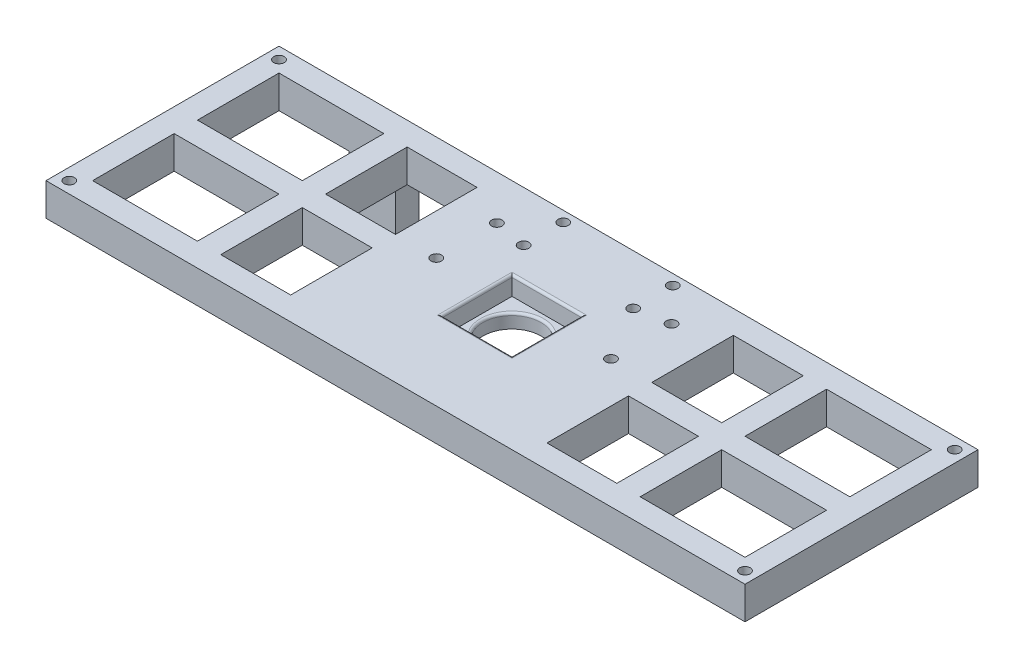
from build123d import *

# Parameters (mm, degrees)
SKETCH_1_W           = 300
SKETCH_1_H           = 100
EXTRUDE_1_DEPTH      = 16
SKETCH_2_W           = 30
SKETCH_2_H           = 30
CUT_EXTRUDE_1_DEPTH  = 8
SKETCH_3_R           = 12.5
CUT_EXTRUDE_2_DEPTH  = 14
CUT_EXTRUDE_3_REACH  = 318.632
SKETCH_4_W           = 50
SKETCH_4_H           = 35
SKETCH_7_W           = 35
SKETCH_7_H           = 16
EXTRUDE_2_DEPTH      = 20
SKETCH_8_W           = 35
SKETCH_8_H           = 16
EXTRUDE_3_DEPTH      = 20
SKETCH_9_W           = 20
SKETCH_9_H           = 10
EXTRUDE_4_DEPTH      = 25
FILLET_1_R           = 1
FILLET_2_R           = 1
SKETCH_13_W          = 35
SKETCH_13_H          = 16
EXTRUDE_6_DEPTH      = 4
SKETCH_14_W          = 35
SKETCH_14_H          = 16
EXTRUDE_7_DEPTH      = 4
SKETCH_17_W          = 35
SKETCH_17_H          = 16
EXTRUDE_8_DEPTH      = 1
SKETCH_18_W          = 35
SKETCH_18_H          = 16
EXTRUDE_9_DEPTH      = 1
SKETCH_19_R          = 2.25
CUT_EXTRUDE_8_DEPTH  = 5
CUT_EXTRUDE_START    = -7
SKETCH_20_R          = 2.25
CUT_EXTRUDE_9_DEPTH  = 7
SKETCH_21_R          = 1.45
CUT_EXTRUDE_10_DEPTH = 5
SKETCH_22_R          = 2.25
CUT_EXTRUDE_11_DEPTH = 5
SKETCH_23_R          = 1.45
CUT_EXTRUDE_12_DEPTH = 5
SKETCH_24_R          = 2.25
CUT_EXTRUDE_13_DEPTH = 5
CUT_EXTRUDE_15_DEPTH = 2


with BuildPart() as part:
    # 草图1 → 凸台-拉伸1 (new body)
    with BuildSketch(Plane(origin=(0, 0, 0), x_dir=(1, 0, 0), z_dir=(0, 1, 0))):
        with Locations((-150, 50)):
            Rectangle(SKETCH_1_W, SKETCH_1_H)
    extrude(amount=EXTRUDE_1_DEPTH)

    # 草图2 → 切除-拉伸1 (cut)
    with BuildSketch(Plane(origin=(0, 16, 0), x_dir=(1, 0, 0), z_dir=(0, 1, 0))):
        with Locations((-150, 50)):
            Rectangle(SKETCH_2_W, SKETCH_2_H)
    extrude(amount=-CUT_EXTRUDE_1_DEPTH, mode=Mode.SUBTRACT)

    # 草图3 → 切除-拉伸2 (cut)
    with BuildSketch(Plane(origin=(0, 8, 0), x_dir=(1, 0, 0), z_dir=(0, 1, 0))):
        with Locations((-150, 50)):
            Circle(SKETCH_3_R)
    extrude(amount=-CUT_EXTRUDE_2_DEPTH, mode=Mode.SUBTRACT)

    # 草图4 → 切除-拉伸3 (cut, up to next)
    with BuildSketch(Plane(origin=(0, 16, 0), x_dir=(1, 0, 0), z_dir=(0, 1, 0)), mode=Mode.PRIVATE) as cut_extrude_3_sk1:
        with Locations((-270, 72.5)):
            Rectangle(SKETCH_4_W, SKETCH_4_H)
    cut_extrude_3_tool1 = extrude(cut_extrude_3_sk1.sketch, amount=-CUT_EXTRUDE_3_REACH, mode=Mode.PRIVATE) & part.part
    # 草图4 → 切除-拉伸3 (cut, up to next)
    with BuildSketch(Plane(origin=(0, 16, 0), x_dir=(1, 0, 0), z_dir=(0, 1, 0)), mode=Mode.PRIVATE) as cut_extrude_3_sk2:
        with Locations((-270, 27.5)):
            Rectangle(SKETCH_4_W, SKETCH_4_H)
    cut_extrude_3_tool2 = extrude(cut_extrude_3_sk2.sketch, amount=-CUT_EXTRUDE_3_REACH, mode=Mode.PRIVATE) & part.part
    # 草图4 → 切除-拉伸3 (cut, up to next)
    with BuildSketch(Plane(origin=(0, 16, 0), x_dir=(1, 0, 0), z_dir=(0, 1, 0)), mode=Mode.PRIVATE) as cut_extrude_3_sk3:
        with Locations((-210, 72.5)):
            Rectangle(SKETCH_4_W, SKETCH_4_H)
    cut_extrude_3_tool3 = extrude(cut_extrude_3_sk3.sketch, amount=-CUT_EXTRUDE_3_REACH, mode=Mode.PRIVATE) & part.part
    # 草图4 → 切除-拉伸3 (cut, up to next)
    with BuildSketch(Plane(origin=(0, 16, 0), x_dir=(1, 0, 0), z_dir=(0, 1, 0)), mode=Mode.PRIVATE) as cut_extrude_3_sk4:
        with Locations((-210, 27.5)):
            Rectangle(SKETCH_4_W, SKETCH_4_H)
    cut_extrude_3_tool4 = extrude(cut_extrude_3_sk4.sketch, amount=-CUT_EXTRUDE_3_REACH, mode=Mode.PRIVATE) & part.part
    # 草图4 → 切除-拉伸3 (cut, up to next)
    with BuildSketch(Plane(origin=(0, 16, 0), x_dir=(1, 0, 0), z_dir=(0, 1, 0)), mode=Mode.PRIVATE) as cut_extrude_3_sk5:
        with Locations((-30, 27.5)):
            Rectangle(SKETCH_4_W, SKETCH_4_H)
    cut_extrude_3_tool5 = extrude(cut_extrude_3_sk5.sketch, amount=-CUT_EXTRUDE_3_REACH, mode=Mode.PRIVATE) & part.part
    # 草图4 → 切除-拉伸3 (cut, up to next)
    with BuildSketch(Plane(origin=(0, 16, 0), x_dir=(1, 0, 0), z_dir=(0, 1, 0)), mode=Mode.PRIVATE) as cut_extrude_3_sk6:
        with Locations((-90, 27.5)):
            Rectangle(SKETCH_4_W, SKETCH_4_H)
    cut_extrude_3_tool6 = extrude(cut_extrude_3_sk6.sketch, amount=-CUT_EXTRUDE_3_REACH, mode=Mode.PRIVATE) & part.part
    # 草图4 → 切除-拉伸3 (cut, up to next)
    with BuildSketch(Plane(origin=(0, 16, 0), x_dir=(1, 0, 0), z_dir=(0, 1, 0)), mode=Mode.PRIVATE) as cut_extrude_3_sk7:
        with Locations((-90, 72.5)):
            Rectangle(SKETCH_4_W, SKETCH_4_H)
    cut_extrude_3_tool7 = extrude(cut_extrude_3_sk7.sketch, amount=-CUT_EXTRUDE_3_REACH, mode=Mode.PRIVATE) & part.part
    # 草图4 → 切除-拉伸3 (cut, up to next)
    with BuildSketch(Plane(origin=(0, 16, 0), x_dir=(1, 0, 0), z_dir=(0, 1, 0)), mode=Mode.PRIVATE) as cut_extrude_3_sk8:
        with Locations((-30, 72.5)):
            Rectangle(SKETCH_4_W, SKETCH_4_H)
    cut_extrude_3_tool8 = extrude(cut_extrude_3_sk8.sketch, amount=-CUT_EXTRUDE_3_REACH, mode=Mode.PRIVATE) & part.part
    add(cut_extrude_3_tool1.solids().sort_by_distance((-270, 16, -72.5))[0], mode=Mode.SUBTRACT)
    add(cut_extrude_3_tool2.solids().sort_by_distance((-270, 16, -27.5))[0], mode=Mode.SUBTRACT)
    add(cut_extrude_3_tool3.solids().sort_by_distance((-210, 16, -72.5))[0], mode=Mode.SUBTRACT)
    add(cut_extrude_3_tool4.solids().sort_by_distance((-210, 16, -27.5))[0], mode=Mode.SUBTRACT)
    add(cut_extrude_3_tool5.solids().sort_by_distance((-30, 16, -27.5))[0], mode=Mode.SUBTRACT)
    add(cut_extrude_3_tool6.solids().sort_by_distance((-90, 16, -27.5))[0], mode=Mode.SUBTRACT)
    add(cut_extrude_3_tool7.solids().sort_by_distance((-90, 16, -72.5))[0], mode=Mode.SUBTRACT)
    add(cut_extrude_3_tool8.solids().sort_by_distance((-30, 16, -72.5))[0], mode=Mode.SUBTRACT)

    # 草图7 → 凸台-拉伸2 (add)
    with BuildSketch(Plane.ZY.offset(185)):
        with Locations((-27.5, 8)):
            Rectangle(SKETCH_7_W, SKETCH_7_H)
        with Locations((-72.5, 8)):
            Rectangle(SKETCH_7_W, SKETCH_7_H)
    extrude(amount=EXTRUDE_2_DEPTH)

    # 草图8 → 凸台-拉伸3 (add)
    with BuildSketch(Plane(origin=(-115, 0, 0), x_dir=(0, 0, -1), z_dir=(1, 0, 0))):
        with Locations((27.5, 8)):
            Rectangle(SKETCH_8_W, SKETCH_8_H)
        with Locations((72.5, 8)):
            Rectangle(SKETCH_8_W, SKETCH_8_H)
    extrude(amount=EXTRUDE_3_DEPTH)

    # 草图9 → 凸台-拉伸4 (add)
    with BuildSketch(Plane.XZ):
        with Locations((-250, -95)):
            Rectangle(SKETCH_9_W, SKETCH_9_H)
    extrude(amount=EXTRUDE_4_DEPTH)

    # 圆角1
    fillet_1_edges = [part.edges().sort_by_distance(p)[0] for p in [
        (-162.5, 8, -50),
    ]]
    fillet(fillet_1_edges, radius=FILLET_1_R)

    # 圆角2
    fillet_2_edges = [part.edges().sort_by_distance(p)[0] for p in [
        (-135, 16, -50),
        (-150, 16, -65),
        (-150, 16, -35),
        (-165, 16, -50),
    ]]
    fillet(fillet_2_edges, radius=FILLET_2_R)

    # 草图13 → 凸台-拉伸6 (add)
    with BuildSketch(Plane.ZY.offset(5)):
        with Locations((-72.5, 8)):
            Rectangle(SKETCH_13_W, SKETCH_13_H)
        with Locations((-27.5, 8)):
            Rectangle(SKETCH_13_W, SKETCH_13_H)
    extrude(amount=EXTRUDE_6_DEPTH)

    # 草图14 → 凸台-拉伸7 (add)
    with BuildSketch(Plane(origin=(-295, 0, 0), x_dir=(0, 0, -1), z_dir=(1, 0, 0))):
        with Locations((72.5, 8)):
            Rectangle(SKETCH_14_W, SKETCH_14_H)
        with Locations((27.5, 8)):
            Rectangle(SKETCH_14_W, SKETCH_14_H)
    extrude(amount=EXTRUDE_7_DEPTH)

    # 草图17 → 凸台-拉伸8 (add)
    with BuildSketch(Plane(origin=(-291, 0, 0), x_dir=(0, 0, -1), z_dir=(1, 0, 0))):
        with Locations((27.5, 8)):
            Rectangle(SKETCH_17_W, SKETCH_17_H)
        with Locations((72.5, 8)):
            Rectangle(SKETCH_17_W, SKETCH_17_H)
    extrude(amount=EXTRUDE_8_DEPTH)

    # 草图18 → 凸台-拉伸9 (add)
    with BuildSketch(Plane.ZY.offset(9)):
        with Locations((-27.5, 8)):
            Rectangle(SKETCH_18_W, SKETCH_18_H)
        with Locations((-72.5, 8)):
            Rectangle(SKETCH_18_W, SKETCH_18_H)
    extrude(amount=EXTRUDE_9_DEPTH)

    # 草图19 → 切除-拉伸8 (cut)
    with BuildSketch(Plane(origin=(0, 16, 0), x_dir=(1, 0, 0), z_dir=(0, 1, 0))):
        with Locations((-295, 95)):
            Circle(SKETCH_19_R)
        with Locations((-295, 5)):
            Circle(SKETCH_19_R)
        with Locations((-5, 5)):
            Circle(SKETCH_19_R)
        with Locations((-5, 95)):
            Circle(SKETCH_19_R)
    extrude(amount=-CUT_EXTRUDE_8_DEPTH, mode=Mode.SUBTRACT)

    # 草图20 → 切除-拉伸9 (cut)
    with BuildSketch(Plane.XZ.offset(CUT_EXTRUDE_START)):
        with Locations((-295, -95)):
            Circle(SKETCH_20_R)
        with Locations((-295, -5)):
            Circle(SKETCH_20_R)
        with Locations((-5, -95)):
            Circle(SKETCH_20_R)
        with Locations((-5, -5)):
            Circle(SKETCH_20_R)
    extrude(amount=CUT_EXTRUDE_9_DEPTH, mode=Mode.SUBTRACT)

    # 草图21 → 切除-拉伸10 (cut)
    with BuildSketch(Plane(origin=(-100.276222054, 16, -200.091791604), x_dir=(-0.00184091553368713, 0, -0.9999983055135633), z_dir=(0, 1, 0))):
        with Locations((-104.543338614, 26.416278164)):
            Circle(SKETCH_21_R)
        with Locations((-121.543309808, 26.447573728)):
            Circle(SKETCH_21_R)
        with Locations((-121.456786778, 73.447494087)):
            Circle(SKETCH_21_R)
        with Locations((-104.456815584, 73.416198523)):
            Circle(SKETCH_21_R)
    extrude(amount=-CUT_EXTRUDE_10_DEPTH, mode=Mode.SUBTRACT)

    # 草图22 → 切除-拉伸11 (cut)
    with BuildSketch(Plane(origin=(0, 16, 0), x_dir=(1, 0, 0), z_dir=(0, 1, 0))):
        with Locations((-173.5, 95.5)):
            Circle(SKETCH_22_R)
        with Locations((-173.5, 78.5)):
            Circle(SKETCH_22_R)
        with Locations((-126.5, 95.5)):
            Circle(SKETCH_22_R)
        with Locations((-126.5, 78.5)):
            Circle(SKETCH_22_R)
    extrude(amount=-CUT_EXTRUDE_11_DEPTH, mode=Mode.SUBTRACT)

    # 草图23 → 切除-拉伸12 (cut)
    with BuildSketch(Plane(origin=(-100.276222054, 16, -200.091791604), x_dir=(-0.00184091553368713, 0, -0.9999983055135633), z_dir=(0, 1, 0))):
        with Locations((-119.069051565, 12.462168574)):
            Circle(SKETCH_23_R)
        with Locations((-145.069007508, 12.510032378)):
            Circle(SKETCH_23_R)
        with Locations((-144.931009437, 87.471558467)):
            Circle(SKETCH_23_R)
        with Locations((-118.931053493, 87.423694663)):
            Circle(SKETCH_23_R)
    extrude(amount=-CUT_EXTRUDE_12_DEPTH, mode=Mode.SUBTRACT)

    # 草图24 → 切除-拉伸13 (cut)
    with BuildSketch(Plane(origin=(0, 16, 0), x_dir=(1, 0, 0), z_dir=(0, 1, 0))):
        with Locations((-187.480826555, 81)):
            Circle(SKETCH_24_R)
        with Locations((-187.480826555, 55)):
            Circle(SKETCH_24_R)
        with Locations((-112.519173445, 81)):
            Circle(SKETCH_24_R)
        with Locations((-112.519173445, 55)):
            Circle(SKETCH_24_R)
    extrude(amount=-CUT_EXTRUDE_13_DEPTH, mode=Mode.SUBTRACT)

    # 草图26 → 切除-拉伸15 (cut)
    with BuildSketch(Plane.XZ):
        Polygon((-260, -90), (-290, -90), (-290, -55), (-245, -55), (-245, -90), (-240, -90), (-240, -100), (0, -100), (0, 0), (-300, 0), (-300, -100), (-260, -100), align=None)
    extrude(amount=-CUT_EXTRUDE_15_DEPTH, mode=Mode.SUBTRACT)


solid = part.part
